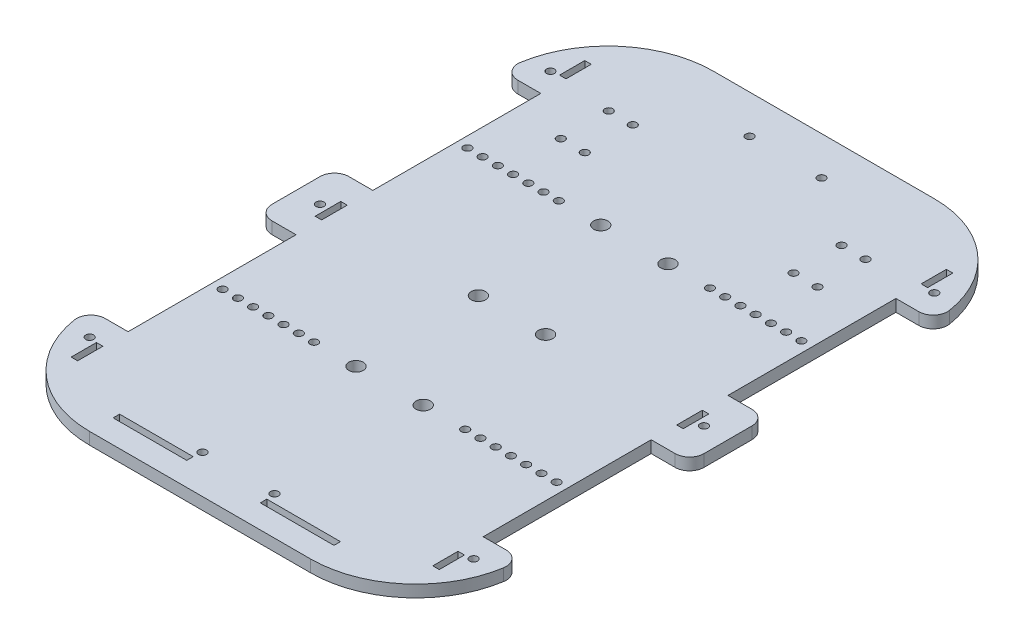
from build123d import *

# Parameters (mm, degrees)
SKETCH2_W           = 2.7
SKETCH2_H           = 10.51
SKETCH2_H_2         = 10.666666666
SKETCH2_W_2         = 30.68
SKETCH2_H_3         = 2.7
BOSS_EXTRUDE4_DEPTH = 5
SKETCH5_R           = 1.65
SKETCH5_R_2         = 3
CUT_EXTRUDE1_DEPTH  = 159.192920196


with BuildPart() as part:
    # Sketch2 → Boss-Extrude4 (new body)
    with BuildSketch(Plane(origin=(0, 0, 0), x_dir=(1, 0, 0), z_dir=(0, 1, 0))):
        with BuildLine():
            Line((46, -130), (-46, -130))
            ThreePointArc((-46, -130), (-74.550970119, -119.478980051), (-89.448061775, -92.947368421))
            ThreePointArc((-89.448061775, -92.947368421), (-88.08864154, -88.106685893), (-83.523326079, -86))
            Line((-83.523326079, -86), (-74, -86))
            Line((-74, -86), (-74, -16))
            Line((-74, -16), (-84, -16))
            ThreePointArc((-84, -16), (-88.242640687, -14.242640687), (-90, -10))
            Line((-90, -10), (-90, 10))
            ThreePointArc((-90, 10), (-88.242640687, 14.242640687), (-84, 16))
            Line((-84, 16), (-74, 16))
            Line((-74, 16), (-74, 86))
            Line((-74, 86), (-83.523326079, 86))
            ThreePointArc((-83.523326079, 86), (-88.08864154, 88.106685893), (-89.448061775, 92.947368421))
            ThreePointArc((-89.448061775, 92.947368421), (-74.550970119, 119.478980051), (-46, 130))
            Line((-46, 130), (46, 130))
            ThreePointArc((46, 130), (74.550970119, 119.478980051), (89.448061775, 92.947368421))
            ThreePointArc((89.448061775, 92.947368421), (88.08864154, 88.106685893), (83.523326079, 86))
            Line((83.523326079, 86), (74, 86))
            Line((74, 86), (74, 16))
            Line((74, 16), (84, 16))
            ThreePointArc((84, 16), (88.242640687, 14.242640687), (90, 10))
            Line((90, 10), (90, -10))
            ThreePointArc((90, -10), (88.242640687, -14.242640687), (84, -16))
            Line((84, -16), (74, -16))
            Line((74, -16), (74, -86))
            Line((74, -86), (83.523326079, -86))
            ThreePointArc((83.523326079, -86), (88.08864154, -88.106685893), (89.448061775, -92.947368421))
            ThreePointArc((89.448061775, -92.947368421), (74.550970119, -119.478980051), (46, -130))
        make_face()
        with Locations((-75.35, 101.765)):
            Rectangle(SKETCH2_W, SKETCH2_H, mode=Mode.SUBTRACT)
        with Locations((75.35, 101.765)):
            Rectangle(SKETCH2_W, SKETCH2_H, mode=Mode.SUBTRACT)
        with Locations((75.35, -101.765)):
            Rectangle(SKETCH2_W, SKETCH2_H, mode=Mode.SUBTRACT)
        with Locations((-75.35, -101.765)):
            Rectangle(SKETCH2_W, SKETCH2_H, mode=Mode.SUBTRACT)
        with Locations((-75.35, 0)):
            Rectangle(SKETCH2_W, SKETCH2_H_2, mode=Mode.SUBTRACT)
        with Locations((75.35, 0)):
            Rectangle(SKETCH2_W, SKETCH2_H_2, mode=Mode.SUBTRACT)
        with Locations((-30.68, -118.87)):
            Rectangle(SKETCH2_W_2, SKETCH2_H_3, mode=Mode.SUBTRACT)
        with Locations((30.68, -118.87)):
            Rectangle(SKETCH2_W_2, SKETCH2_H_3, mode=Mode.SUBTRACT)
    extrude(amount=BOSS_EXTRUDE4_DEPTH)

    # Sketch5 → Cut-Extrude1 (cut, through all)
    with BuildSketch(Plane(origin=(0, 5, 0), x_dir=(1, 0, 0), z_dir=(0, 1, 0))):
        with Locations((-69.6, -51)):
            Circle(SKETCH5_R)
        with Locations((-63.25, -51)):
            Circle(SKETCH5_R)
        with Locations((-56.9, -51)):
            Circle(SKETCH5_R)
        with Locations((-50.55, -51)):
            Circle(SKETCH5_R)
        with Locations((-44.2, -51)):
            Circle(SKETCH5_R)
        with Locations((-37.85, -51)):
            Circle(SKETCH5_R)
        with Locations((-31.5, -51)):
            Circle(SKETCH5_R)
        with Locations((31.5, -51)):
            Circle(SKETCH5_R)
        with Locations((37.85, -51)):
            Circle(SKETCH5_R)
        with Locations((44.2, -51)):
            Circle(SKETCH5_R)
        with Locations((50.55, -51)):
            Circle(SKETCH5_R)
        with Locations((56.9, -51)):
            Circle(SKETCH5_R)
        with Locations((63.25, -51)):
            Circle(SKETCH5_R)
        with Locations((69.6, -51)):
            Circle(SKETCH5_R)
        with Locations((69.6, 51)):
            Circle(SKETCH5_R)
        with Locations((63.25, 51)):
            Circle(SKETCH5_R)
        with Locations((56.9, 51)):
            Circle(SKETCH5_R)
        with Locations((50.55, 51)):
            Circle(SKETCH5_R)
        with Locations((44.2, 51)):
            Circle(SKETCH5_R)
        with Locations((37.85, 51)):
            Circle(SKETCH5_R)
        with Locations((31.5, 51)):
            Circle(SKETCH5_R)
        with Locations((-31.5, 51)):
            Circle(SKETCH5_R)
        with Locations((-37.85, 51)):
            Circle(SKETCH5_R)
        with Locations((-44.2, 51)):
            Circle(SKETCH5_R)
        with Locations((-50.55, 51)):
            Circle(SKETCH5_R)
        with Locations((-56.9, 51)):
            Circle(SKETCH5_R)
        with Locations((-63.25, 51)):
            Circle(SKETCH5_R)
        with Locations((-69.6, 51)):
            Circle(SKETCH5_R)
        with Locations((-14, -51)):
            Circle(SKETCH5_R_2)
        with Locations((14, -51)):
            Circle(SKETCH5_R_2)
        with Locations((14, 51)):
            Circle(SKETCH5_R_2)
        with Locations((-14, 51)):
            Circle(SKETCH5_R_2)
        with Locations((-14, 0)):
            Circle(SKETCH5_R_2)
        with Locations((14, 0)):
            Circle(SKETCH5_R_2)
        with Locations((-80, 96)):
            Circle(SKETCH5_R)
        with Locations((-80, 0)):
            Circle(SKETCH5_R)
        with Locations((80, 0)):
            Circle(SKETCH5_R)
        with Locations((-80, -96)):
            Circle(SKETCH5_R)
        with Locations((80, -96)):
            Circle(SKETCH5_R)
        with Locations((80, 96)):
            Circle(SKETCH5_R)
        with Locations((-15, -114)):
            Circle(SKETCH5_R)
        with Locations((15, -114)):
            Circle(SKETCH5_R)
        with Locations((15, 114)):
            Circle(SKETCH5_R)
        with Locations((-15, 114)):
            Circle(SKETCH5_R)
        with Locations((-53.5, 93.83)):
            Circle(SKETCH5_R)
        with Locations((-53.5, 73.83)):
            Circle(SKETCH5_R)
        with Locations((-43.5, 73.83)):
            Circle(SKETCH5_R)
        with Locations((-43.5, 93.83)):
            Circle(SKETCH5_R)
        with Locations((43.5, 73.83)):
            Circle(SKETCH5_R)
        with Locations((53.5, 73.83)):
            Circle(SKETCH5_R)
        with Locations((43.5, 93.83)):
            Circle(SKETCH5_R)
        with Locations((53.5, 93.83)):
            Circle(SKETCH5_R)
    extrude(amount=-CUT_EXTRUDE1_DEPTH, mode=Mode.SUBTRACT)


solid = part.part
